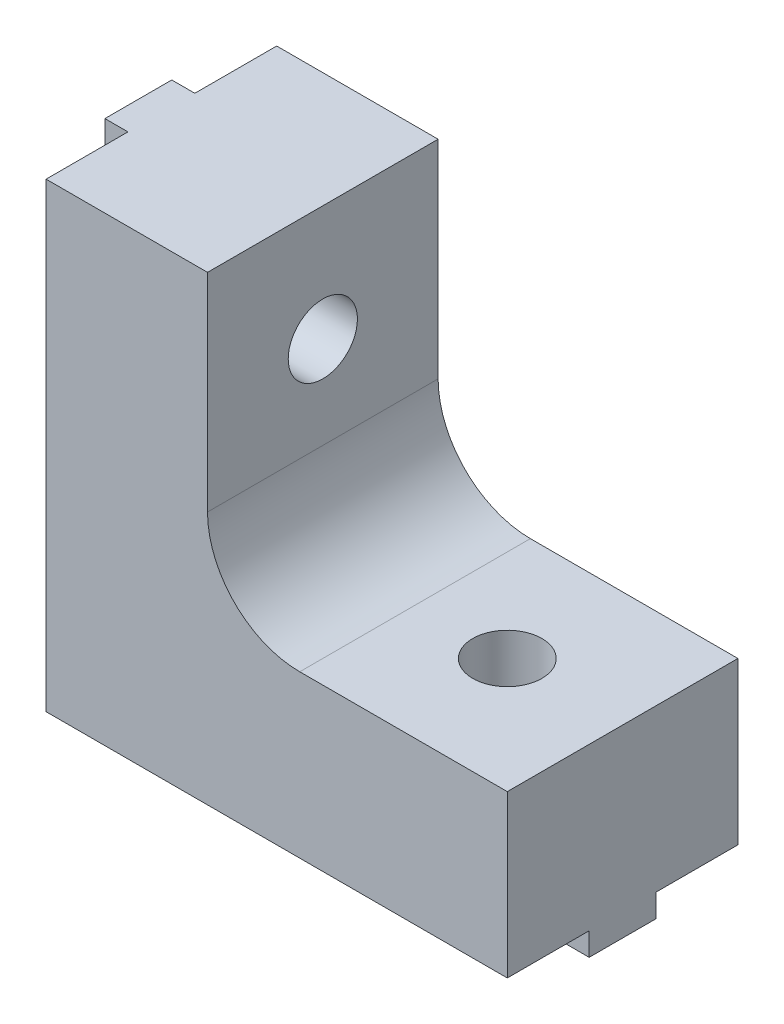
from build123d import *

# Parameters (mm, degrees)
MAIN_DEPTH                         = 10
ESQUISSE4_W                        = 2.9
ESQUISSE4_H                        = 20
MAKERBEAMFIXVERTICAL_DEPTH         = 1
MAKERBEAMVERTICALHOLE_DEPTH        = 31
MAKERBEAMVERTICALHOLE_DEPTH_BACK   = 31
ESQUISSE2_R                        = 1.5
ESQUISSE5_W                        = 20
ESQUISSE5_H                        = 2.9
MAKERBEAMFIXHORIZONTAL_DEPTH       = 1
MAKERBEAMHORIZONTALHOLE_DEPTH      = 31
MAKERBEAMHORIZONTALHOLE_DEPTH_BACK = 31
ESQUISSE3_R                        = 1.5


with BuildPart() as part:
    # Esquisse1 → Main (new body)
    with BuildSketch(Plane.XY):
        with BuildLine():
            Line((0, 0), (20, 0))
            Line((20, 0), (20, 7))
            Line((20, 7), (11, 7))
            ThreePointArc((11, 7), (8.171572875, 8.171572875), (7, 11))
            Line((7, 11), (7, 20))
            Line((7, 20), (0, 20))
            Line((0, 20), (0, 0))
        make_face()
    extrude(amount=MAIN_DEPTH)

    # Esquisse4 → MakerBeamFixVertical (add)
    with BuildSketch(Plane.ZY):
        with Locations((5, 10)):
            Rectangle(ESQUISSE4_W, ESQUISSE4_H)
    extrude(amount=MAKERBEAMFIXVERTICAL_DEPTH)

    # Esquisse2 → MakerBeamVerticalHole (cut, two sides: drawn at the far end of the back side and taken through both)
    with BuildSketch(Plane.ZY.offset(-MAKERBEAMVERTICALHOLE_DEPTH_BACK)):
        with Locations((5, 15)):
            Circle(ESQUISSE2_R)
    extrude(amount=MAKERBEAMVERTICALHOLE_DEPTH + MAKERBEAMVERTICALHOLE_DEPTH_BACK, mode=Mode.SUBTRACT)

    # Esquisse5 → MakerBeamFixHorizontal (add)
    with BuildSketch(Plane(origin=(0, 0, 0), x_dir=(-1, 0, 0), z_dir=(0, -1, 0))):
        with Locations((-10, -5)):
            Rectangle(ESQUISSE5_W, ESQUISSE5_H)
    extrude(amount=MAKERBEAMFIXHORIZONTAL_DEPTH)

    # Esquisse3 → MakerBeamHorizontalHole (cut, two sides: drawn at the far end of the back side and taken through both)
    with BuildSketch(Plane.XZ.offset(-MAKERBEAMHORIZONTALHOLE_DEPTH_BACK)):
        with Locations((15, 5)):
            Circle(ESQUISSE3_R)
    extrude(amount=MAKERBEAMHORIZONTALHOLE_DEPTH + MAKERBEAMHORIZONTALHOLE_DEPTH_BACK, mode=Mode.SUBTRACT)


solid = part.part
